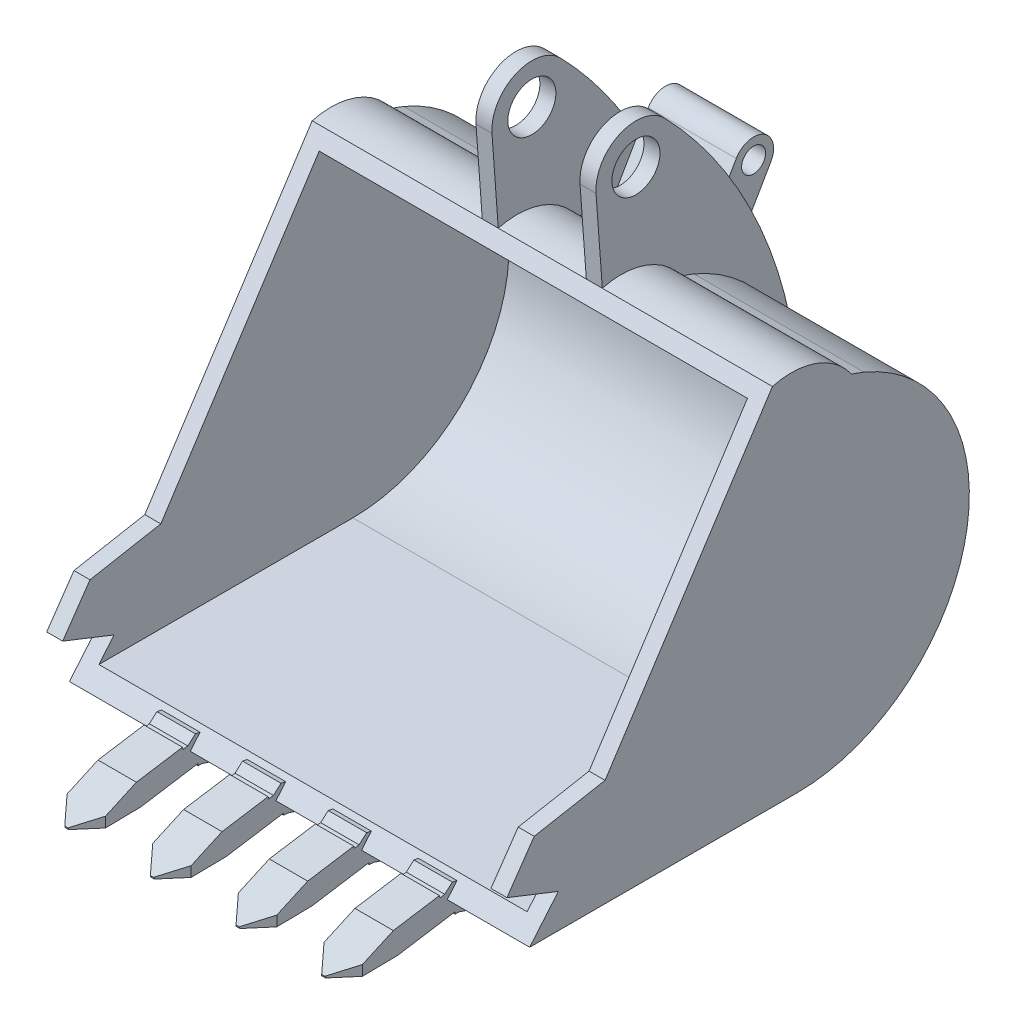
from build123d import *

# Parameters (mm, degrees)
BOSS_EXTRUDE2_DEPTH = 287.5
SHELL1_START        = -267.5
SHELL1_DEPTH        = 535
SKETCH4_R           = 15
BOSS_EXTRUDE3_DEPTH = 55
BOSS_EXTRUDE4_DEPTH = 287.5
BOSS_EXTRUDE5_START = 75
SKETCH6_R           = 30
BOSS_EXTRUDE5_DEPTH = 20
BOSS_EXTRUDE6_DEPTH = 48
CUT_EXTRUDE1_DEPTH  = 849.457518617
LPATTERN1_COUNT     = 4
LPATTERN1_PITCH     = 107


# Read off the part's stored shape, not the designer's step: Shell1
with BuildPart() as part:
    # Sketch1 → Boss-Extrude2 (new, symmetric)
    with BuildSketch(Plane(origin=(0, 0, 0), x_dir=(0, 0, -1), z_dir=(1, 0, 0))):
        with BuildLine():
            Line((-17.131272745, -20.34711833), (18.677931789, 22.184112876))
            Line((18.677931789, 22.184112876), (-45.510379426, 47.499339584))
            Line((-45.510379426, 47.499339584), (-11.452124758, 96.896052925))
            Line((-11.452124758, 96.896052925), (77.065235948, 113.164945136))
            Line((77.065235948, 113.164945136), (286.140990264, 434.746925642))
            Line((286.140990264, 434.746925642), (400.489865708, 393.127338659))
            ThreePointArc((400.489865708, 393.127338659), (527.907623498, 152.23232826), (317, -20.34711833))
            Line((317, -20.34711833), (-17.131272745, -20.34711833))
        make_face()
    extrude(amount=BOSS_EXTRUDE2_DEPTH, both=True)

    # Shell1 outline → Shell1 (cut)
    with BuildSketch(Plane.YZ.offset(SHELL1_START)):
        with BuildLine():
            Line((-0.34711833, 0.292256559), (-0.347118332, -316.999753995))
            ThreePointArc((-0.347118332, -316.999753995), (155.954494492, -508.255406969), (374.506719993, -393.173507026))
            Line((374.506719993, -393.173507026), (417.536054052, -274.951383325))
            Line((417.536054052, -274.951383325), (113.164945136, -77.065235948))
            Line((113.164945136, -77.065235948), (96.896052925, 11.452124758))
            Line((96.896052925, 11.452124758), (47.499339584, 45.510379426))
            Line((47.499339584, 45.510379426), (22.184112876, -18.677931789))
            Line((22.184112876, -18.677931789), (-0.34711833, 0.292256559))
        make_face()
    extrude(amount=SHELL1_DEPTH, mode=Mode.SUBTRACT)

    # Sketch4 → Boss-Extrude3 (add, symmetric)
    with BuildSketch(Plane(origin=(0, 0, 0), x_dir=(0, 0, -1), z_dir=(1, 0, 0))):
        with BuildLine():
            Line((473.490355169, 471.5), (422.135414248, 382.550633104))
            ThreePointArc((422.135414248, 382.550633104), (443.346279027, 368.983010842), (462.826942921, 353.030428204))
            Line((462.826942921, 353.030428204), (516.791625358, 446.5))
            ThreePointArc((516.791625358, 446.5), (507.640990264, 480.650635095), (473.490355169, 471.5))
        make_face()
        with Locations((495.140990264, 459)):
            Circle(SKETCH4_R, mode=Mode.SUBTRACT)
    extrude(amount=BOSS_EXTRUDE3_DEPTH, both=True)

    # Sketch5 → Boss-Extrude4 (add, symmetric)
    with BuildSketch(Plane(origin=(0, 0, 0), x_dir=(0, 0, -1), z_dir=(1, 0, 0))):
        with BuildLine():
            Line((286.140990264, 434.746925642), (384.921412729, 398.793792137))
            ThreePointArc((384.921412729, 398.793792137), (341.171815777, 432.267819258), (286.140990264, 434.746925642))
        make_face()
    extrude(amount=BOSS_EXTRUDE4_DEPTH, both=True)

    # Sketch6 → Boss-Extrude5 (add)
    with BuildSketch(Plane(origin=(0, 0, 0), x_dir=(0, 0, -1), z_dir=(1, 0, 0)).offset(BOSS_EXTRUDE5_START)):
        with BuildLine():
            ThreePointArc((364.02781167, 579.815744274), (307.663748085, 590.61449937), (278.276573516, 541.320333932))
            Line((278.276573516, 541.320333932), (286.140990264, 434.746925642))
            ThreePointArc((286.140990264, 434.746925642), (341.171815777, 432.267819258), (384.921412729, 398.793792137))
            Line((384.921412729, 398.793792137), (400.489865708, 393.127338659))
            ThreePointArc((400.489865708, 393.127338659), (487.746891868, 325.745206641), (530.177667873, 223.99173212))
            ThreePointArc((530.177667873, 223.99173212), (477.038065131, 415.881856126), (364.02781167, 579.815744274))
        make_face()
        with Locations((328.140990264, 545)):
            Circle(SKETCH6_R, mode=Mode.SUBTRACT)
    boss_extrude5 = extrude(amount=-BOSS_EXTRUDE5_DEPTH)

    # Mirror1: Boss-Extrude5 across plane
    add(boss_extrude5.mirror(Plane(origin=(0, 0, 0), x_dir=(0, 0, 1), z_dir=(1, 0, 0))))

    # Sketch9 → Boss-Extrude6 (add)
    with BuildSketch(Plane(origin=(-184.5, 0, 0), x_dir=(0, 0, -1), z_dir=(1, 0, 0))):
        Polygon((-2.207998194, -40.938965281), (-7.30496659, -40.938965281), (-7.744921849, -38.400642166), (-78.864458205, -49.626128726), (-147.468055977, -50.72115136), (-147.941109389, -48.777901384), (-84.440877624, -20.13490752), (-26.871687982, -11.048203673), (-26.183722798, -13.874286929), (-20.257094768, -12.938829716), (-10.765705608, -4.578537278), (-4.89400709, -5.81269955), (-17.131272745, -20.34711833), (62.868727255, -20.34711833), (63.601430642, -34.327931817), (5.327818547, -43.557565254), align=None)
    boss_extrude6 = extrude(amount=BOSS_EXTRUDE6_DEPTH)

    # Sketch10 → Cut-Extrude1 (cut, symmetric)
    with BuildSketch(Plane(origin=(0, 0, 0), x_dir=(1, 0, 0), z_dir=(0, 1, 0))):
        Polygon((-184.5, -123.07463289), (-162.5, -147.941109389), (-184.5, -147.941109389), align=None)
        Polygon((-158.5, -147.941109389), (-136.5, -123.07463289), (-136.5, -147.941109389), align=None)
    cut_extrude1 = extrude(amount=CUT_EXTRUDE1_DEPTH, both=True, mode=Mode.SUBTRACT)

    # LPattern1: Boss-Extrude6, Cut-Extrude1 ×4
    with Locations(*[(i * LPATTERN1_PITCH, 0, 0) for i in range(1, LPATTERN1_COUNT)]):
        add(boss_extrude6)
        add(cut_extrude1, mode=Mode.SUBTRACT)


solid = part.part
